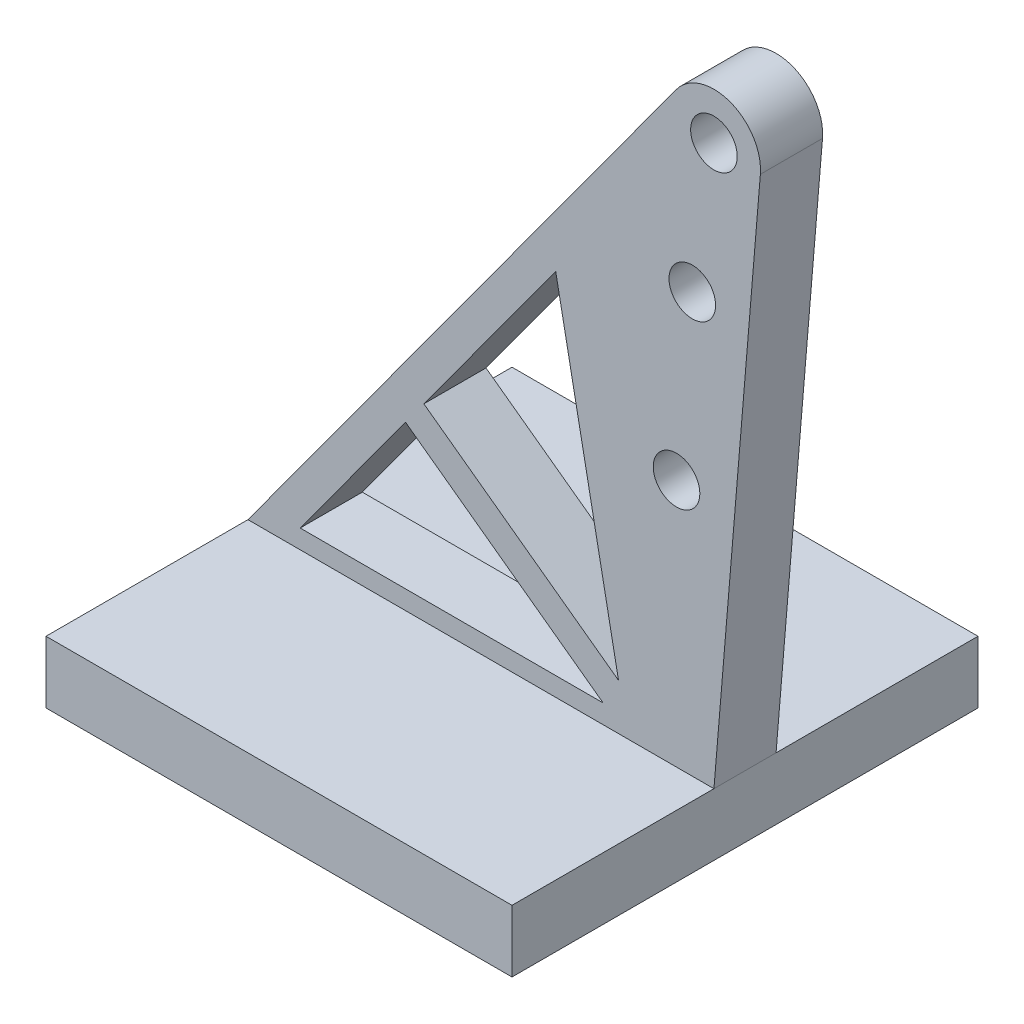
from build123d import *

# Parameters (mm, degrees)
SKETCH1_W           = 15
SKETCH1_H           = 15
BOSS_EXTRUDE1_DEPTH = 2
BOSS_EXTRUDE2_DEPTH = 1
SKETCH3_R           = 0.75
CUT_EXTRUDE2_DEPTH  = 25.80927246
SKETCH6_R           = 0.75
CUT_EXTRUDE3_DEPTH  = 70


with BuildPart() as part:
    # Sketch1 → Boss-Extrude1 (new body)
    with BuildSketch(Plane(origin=(0, 0, 0), x_dir=(1, 0, 0), z_dir=(0, 1, 0))):
        Rectangle(SKETCH1_W, SKETCH1_H)
    extrude(amount=BOSS_EXTRUDE1_DEPTH)

    # Sketch2 → Boss-Extrude2 (add, symmetric)
    with BuildSketch(Plane.XY):
        with BuildLine():
            Line((-7.5, 2), (6.288556431, 20.884536307))
            ThreePointArc((6.288556431, 20.884536307), (8.024272009, 21.405396336), (8.994782593, 19.875))
            Line((8.994782593, 19.875), (7.5, 2))
            Line((7.5, 2), (-7.5, 2))
        make_face()
    extrude(amount=BOSS_EXTRUDE2_DEPTH, both=True)

    # Sketch3 → Cut-Extrude2 (cut, through all)
    with BuildSketch(Plane(origin=(0, 0, -1), x_dir=(-1, 0, 0), z_dir=(0, 0, -1))):
        with Locations((-7.5, 20)):
            Circle(SKETCH3_R)
    extrude(amount=-CUT_EXTRUDE2_DEPTH, mode=Mode.SUBTRACT)

    # Sketch6 → Cut-Extrude3 (cut)
    with BuildSketch(Plane.XY.offset(1)):
        with Locations((6.803358906, 15.5)):
            Circle(SKETCH6_R)
        with Locations((6.295860941, 10)):
            Circle(SKETCH6_R)
        Polygon((-2.426826913, 7.252314542), (-5.818198492, 2.607558578), (3.934539708, 2.607558578), align=None)
        Polygon((-1.837136041, 8.059943588), (4.428469544, 3.485107606), (2.407598661, 13.873448939), align=None)
    extrude(amount=-CUT_EXTRUDE3_DEPTH, mode=Mode.SUBTRACT)


solid = part.part
